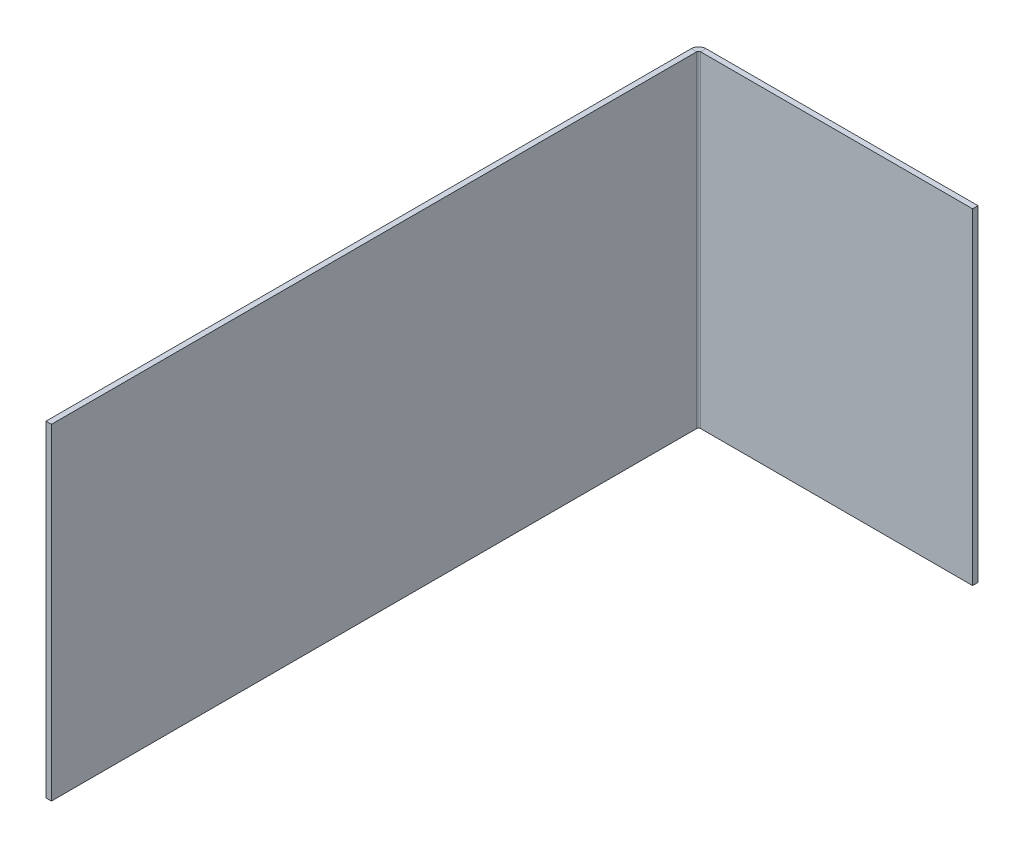
from build123d import *

# Parameters (mm, degrees)
SKETCH2_W          = 100
SKETCH2_H          = 120
BASE_FLANGE1_DEPTH = 2
EDGE_FLANGE1_DEPTH = 120


# Sheet-metal steps are written as plain solids
with BuildPart() as part:
    # Sketch2 → Base-Flange1 (new body)
    with BuildSketch(Plane.XY):
        Rectangle(SKETCH2_W, SKETCH2_H)
    extrude(amount=-BASE_FLANGE1_DEPTH)

    # Edge-Flange1 section (across the edge) → Edge-Flange1 (add)
    with BuildSketch(Plane(origin=(-50.7366, 60, 0), x_dir=(1, 0, 0), z_dir=(0, -1, 0))):
        with BuildLine():
            Line((-2, 0.7366), (-2, 238))
            Line((-2, 238), (0, 238))
            Line((0, 238), (0, 0.7366))
            ThreePointArc((0, 0.7366), (0.215745145, 0.215745145), (0.7366, 0))
            Line((0.7366, 0), (0.7366, -2))
            ThreePointArc((0.7366, -2), (-1.198468417, -1.198468417), (-2, 0.7366))
        make_face()
    extrude(amount=EDGE_FLANGE1_DEPTH)


solid = part.part
